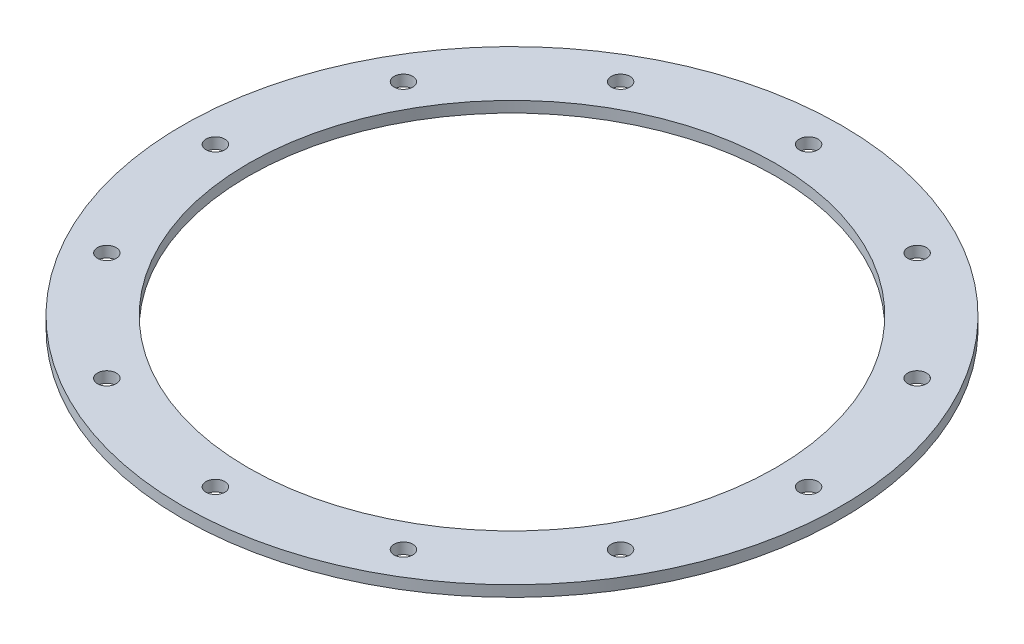
from build123d import *

# Parameters (mm, degrees)
SKETCH1_W                    = 9.525
SKETCH1_H                    = 1.5875
F_36_0_1065_DIAMETER_HOLE1_D = 2.7051
SCREW_PASSTHROUGHS_COUNT     = 12


with BuildPart() as part:
    # Sketch1 → Main (revolve)
    with BuildSketch(Plane.XY):
        with Locations((-42.8625, 0.79375)):
            Rectangle(SKETCH1_W, SKETCH1_H)
    revolve(axis=Axis((0, 55, 0), (0, -1, 0)))

    # #36 (0.1065) Diameter Hole1 (through all)
    with Locations(Plane(origin=(0, 0, 0), x_dir=(-1, 0, 0), z_dir=(0, -1, 0))):
        with Locations((42.8625, 0)):
            f_36_0_1065_diameter_hole1 = Hole(F_36_0_1065_DIAMETER_HOLE1_D / 2)

    # Screw Passthroughs: #36 (0.1065) Diameter Hole1 ×12 about axis
    screw_passthroughs_axis = Axis((0, 55, 0), (0, -1, 0))
    for i in range(1, SCREW_PASSTHROUGHS_COUNT):
        add(f_36_0_1065_diameter_hole1.rotate(screw_passthroughs_axis, i * 360 / SCREW_PASSTHROUGHS_COUNT), mode=Mode.SUBTRACT)


solid = part.part
